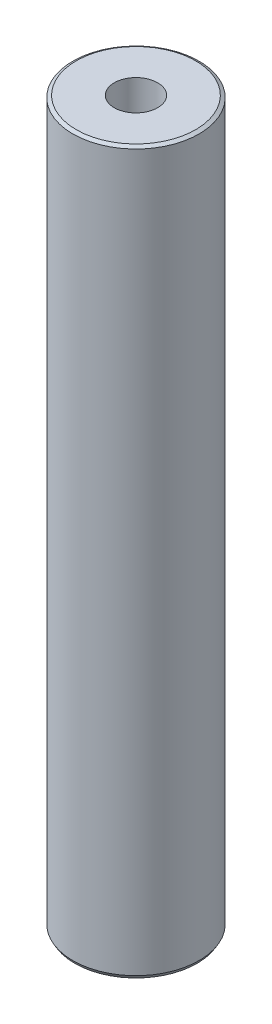
from build123d import *
from OCP.BRepFilletAPI import BRepFilletAPI_MakeChamfer

# Parameters (mm, degrees)
SKETCH1_R           = 52.5
BOSS_EXTRUDE1_DEPTH = 600
SKETCH2_R           = 18.035836795
CUT_EXTRUDE1_DEPTH  = 605.576297914
CHAMFER1_SIZE       = 1.64174657
CHAMFER1_SIZE2      = 2.843588473


with BuildPart() as part:
    # Sketch1 → Boss-Extrude1 (new body)
    with BuildSketch(Plane(origin=(0, 0, 0), x_dir=(1, 0, 0), z_dir=(0, 1, 0))):
        Circle(SKETCH1_R)
    extrude(amount=BOSS_EXTRUDE1_DEPTH)

    # Sketch2 → Cut-Extrude1 (cut, through all)
    with BuildSketch(Plane(origin=(0, 0, 0), x_dir=(1, 0, 0), z_dir=(0, 1, 0))):
        Circle(SKETCH2_R)
    extrude(amount=CUT_EXTRUDE1_DEPTH, mode=Mode.SUBTRACT)

    # Chamfer1: one chamfer whose edges measure the first distance from different faces: ONE call of the kernel's chamfer builder (chamfer() names one face for all edges)
    chamfer1_edges_1 = [part.edges().sort_by_distance(p)[0] for p in [
        (-52.5, 600, 0),
    ]]
    chamfer1_side_1 = [part.faces().sort_by_distance(p)[0] for p in [
        (-52.5, 300, 0),
    ]]
    chamfer1_edges_2 = [part.edges().sort_by_distance(p)[0] for p in [
        (-52.5, 0, 0),
    ]]
    chamfer1_side_2 = [part.faces().sort_by_distance(p)[0] for p in [
        (-51.01507576, 0, 0),
    ]]
    chamfer1 = BRepFilletAPI_MakeChamfer(part.part.solid().wrapped)
    for e in chamfer1_edges_1:
        chamfer1.Add(CHAMFER1_SIZE, CHAMFER1_SIZE2, e.wrapped, chamfer1_side_1[0].wrapped)  # the first distance lies on this face
    for e in chamfer1_edges_2:
        chamfer1.Add(CHAMFER1_SIZE, CHAMFER1_SIZE2, e.wrapped, chamfer1_side_2[0].wrapped)  # the first distance lies on this face
    add(Compound.cast(chamfer1.Shape()), mode=Mode.REPLACE)


solid = part.part
